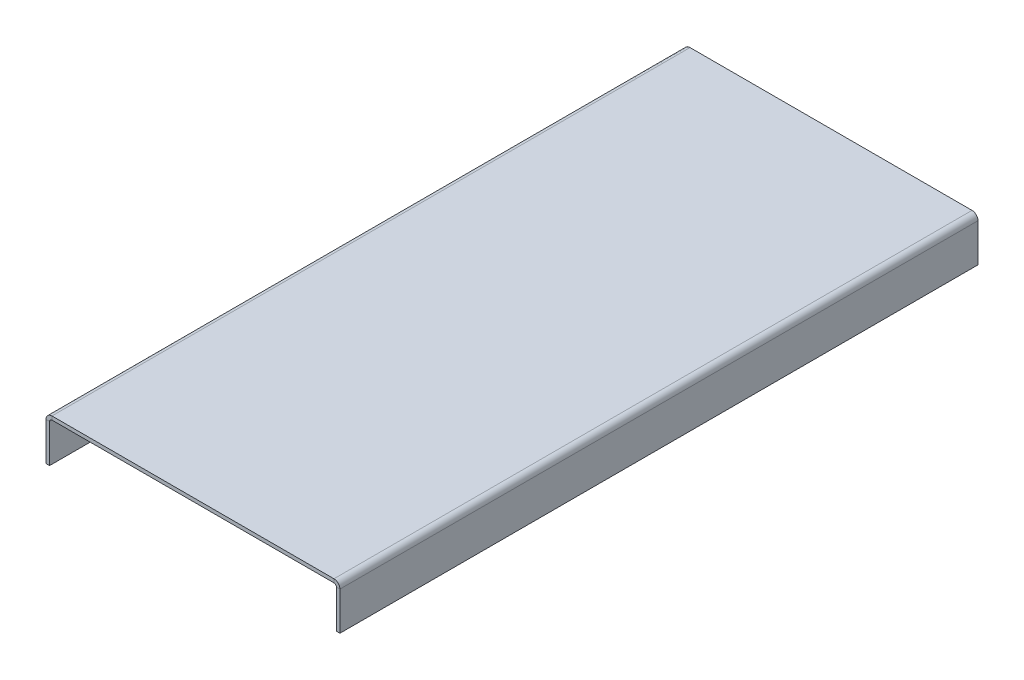
from build123d import *

# Parameters (mm, degrees)
SM_BASE_FLANGE_1_DEPTH = 534


# Sheet-metal steps are written as plain solids
with BuildPart() as part:
    # Sketch 1 → Базовая кромка1 (new body)
    with BuildSketch(Plane.XY):
        with BuildLine():
            Line((120, 86), (120, 118))
            ThreePointArc((120, 118), (119.414213562, 119.414213562), (118, 120))
            Line((118, 120), (-118, 120))
            ThreePointArc((-118, 120), (-119.414213562, 119.414213562), (-120, 118))
            Line((-120, 118), (-120, 86))
            Line((-120, 86), (-123, 86))
            Line((-123, 86), (-123, 118))
            ThreePointArc((-123, 118), (-121.535533906, 121.535533906), (-118, 123))
            Line((-118, 123), (118, 123))
            ThreePointArc((118, 123), (121.535533906, 121.535533906), (123, 118))
            Line((123, 118), (123, 86))
            Line((123, 86), (120, 86))
        make_face()
    extrude(amount=SM_BASE_FLANGE_1_DEPTH)


solid = part.part
